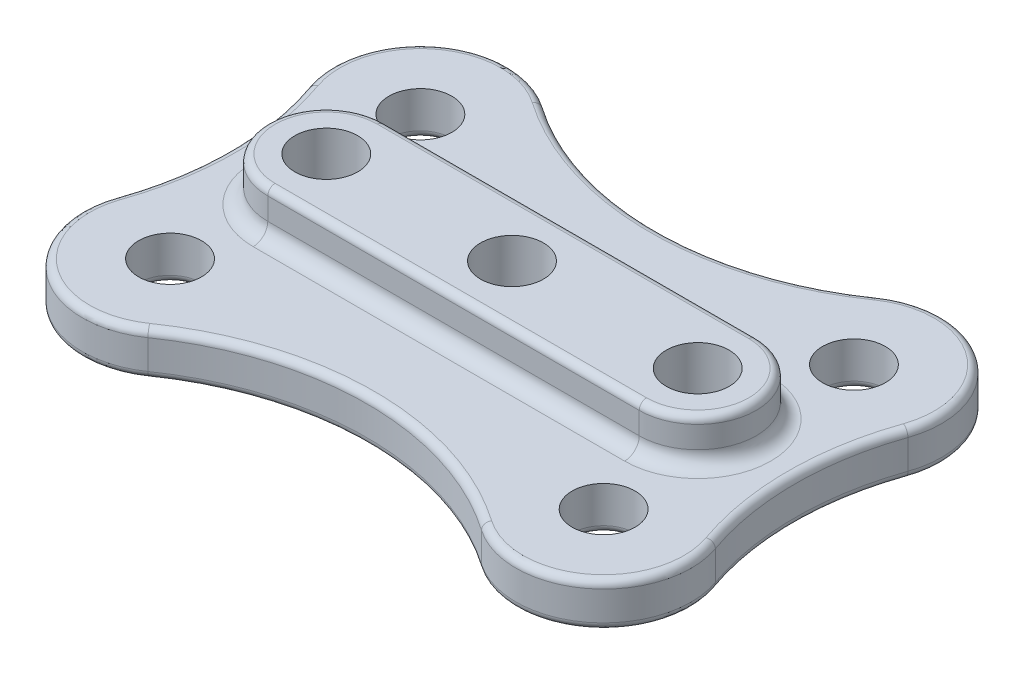
from build123d import *

# Parameters (mm, degrees)
SKETCH1_R           = 2.15
BOSS_EXTRUDE1_DEPTH = 3
FILLET1_R           = 20
SKETCH2_R           = 2.15
BOSS_EXTRUDE2_DEPTH = 3
FILLET2_R           = 0.5
FILLET3_R           = 1


with BuildPart() as part:
    # Sketch1 → Boss-Extrude1 (new body)
    with BuildSketch(Plane(origin=(0, 0, 0), x_dir=(1, 0, 0), z_dir=(0, 1, 0))):
        with BuildLine():
            Line((-11.238128062, 13.369090052), (0, 4.989544408))
            Line((0, 4.989544408), (11.238128062, 13.369090052))
            ThreePointArc((11.238128062, 13.369090052), (18.695012917, 13.143844096), (20.168373744, 5.830494975))
            Line((20.168373744, 5.830494975), (17.191273403, 0))
            Line((17.191273403, 0), (20.168373744, -5.830494975))
            ThreePointArc((20.168373744, -5.830494975), (18.695012917, -13.143844096), (11.238128062, -13.369090052))
            Line((11.238128062, -13.369090052), (0, -4.989544408))
            Line((0, -4.989544408), (-11.238128062, -13.369090052))
            ThreePointArc((-11.238128062, -13.369090052), (-18.695012917, -13.143844096), (-20.168373744, -5.830494975))
            Line((-20.168373744, -5.830494975), (-17.191273403, 0))
            Line((-17.191273403, 0), (-20.168373744, 5.830494975))
            ThreePointArc((-20.168373744, 5.830494975), (-18.695012917, 13.143844096), (-11.238128062, 13.369090052))
        make_face()
        Circle(SKETCH1_R, mode=Mode.SUBTRACT)
        with Locations((14.824677681, 8.55903165)):
            Circle(SKETCH1_R, mode=Mode.SUBTRACT)
        with Locations((14.824677681, -8.55903165)):
            Circle(SKETCH1_R, mode=Mode.SUBTRACT)
        with Locations((-14.824677681, -8.55903165)):
            Circle(SKETCH1_R, mode=Mode.SUBTRACT)
        with Locations((-14.824677681, 8.55903165)):
            Circle(SKETCH1_R, mode=Mode.SUBTRACT)
        with Locations((12.7, 0)):
            Circle(SKETCH1_R, mode=Mode.SUBTRACT)
        with Locations((-12.7, 0)):
            Circle(SKETCH1_R, mode=Mode.SUBTRACT)
    extrude(amount=BOSS_EXTRUDE1_DEPTH)

    # Fillet1
    fillet1_edges = [part.edges().sort_by_distance(p)[0] for p in [
        (17.191273403, 1.5, 0),
        (-17.191273403, 1.5, 0),
        (0, 1.5, 4.989544408),
        (0, 1.5, -4.989544408),
    ]]
    fillet(fillet1_edges, radius=FILLET1_R)

    # Sketch2 → Boss-Extrude2 (add)
    with BuildSketch(Plane(origin=(0, 3, 0), x_dir=(1, 0, 0), z_dir=(0, 1, 0))):
        with BuildLine():
            Line((12.7, 4), (-12.7, 4))
            ThreePointArc((-12.7, 4), (-16.7, 0), (-12.7, -4))
            Line((-12.7, -4), (12.7, -4))
            ThreePointArc((12.7, -4), (16.7, 0), (12.7, 4))
        make_face()
        with Locations((-12.7, 0)):
            Circle(SKETCH2_R, mode=Mode.SUBTRACT)
        Circle(SKETCH2_R, mode=Mode.SUBTRACT)
        with Locations((12.7, 0)):
            Circle(SKETCH2_R, mode=Mode.SUBTRACT)
    extrude(amount=BOSS_EXTRUDE2_DEPTH)

    # Fillet2
    fillet2_edges = [part.edges().sort_by_distance(p)[0] for p in [
        (-14.85, 0, 0),
        (-16.974677681, 0, -8.55903165),
        (-16.974677681, 0, 8.55903165),
        (12.674677681, 0, 8.55903165),
        (12.674677681, 0, -8.55903165),
        (10.55, 0, 0),
        (-2.15, 0, 0),
        (-18.454651703, 0, 13.336404213),
        (0, 0, 9.918547835),
        (18.454651703, 0, 13.336404213),
        (19.375502051, 0, 0),
        (18.454651703, 0, -13.336404213),
        (0, 0, -9.918547835),
        (-18.454651703, 0, -13.336404213),
        (-19.375502051, 0, 0),
        (0, 3, -9.918547835),
        (18.454651703, 3, -13.336404213),
        (19.375502051, 3, 0),
        (18.454651703, 3, 13.336404213),
        (0, 3, 9.918547835),
        (-18.454651703, 3, 13.336404213),
        (-19.375502051, 3, 0),
        (-18.454651703, 3, -13.336404213),
        (-16.7, 6, 0),
        (0, 6, -4),
        (16.7, 6, 0),
        (0, 6, 4),
    ]]
    fillet(fillet2_edges, radius=FILLET2_R)

    # Fillet3
    fillet3_edges = [part.edges().sort_by_distance(p)[0] for p in [
        (-16.7, 3, 0),
        (0, 3, -4),
        (16.7, 3, 0),
        (0, 3, 4),
    ]]
    fillet(fillet3_edges, radius=FILLET3_R)


solid = part.part
